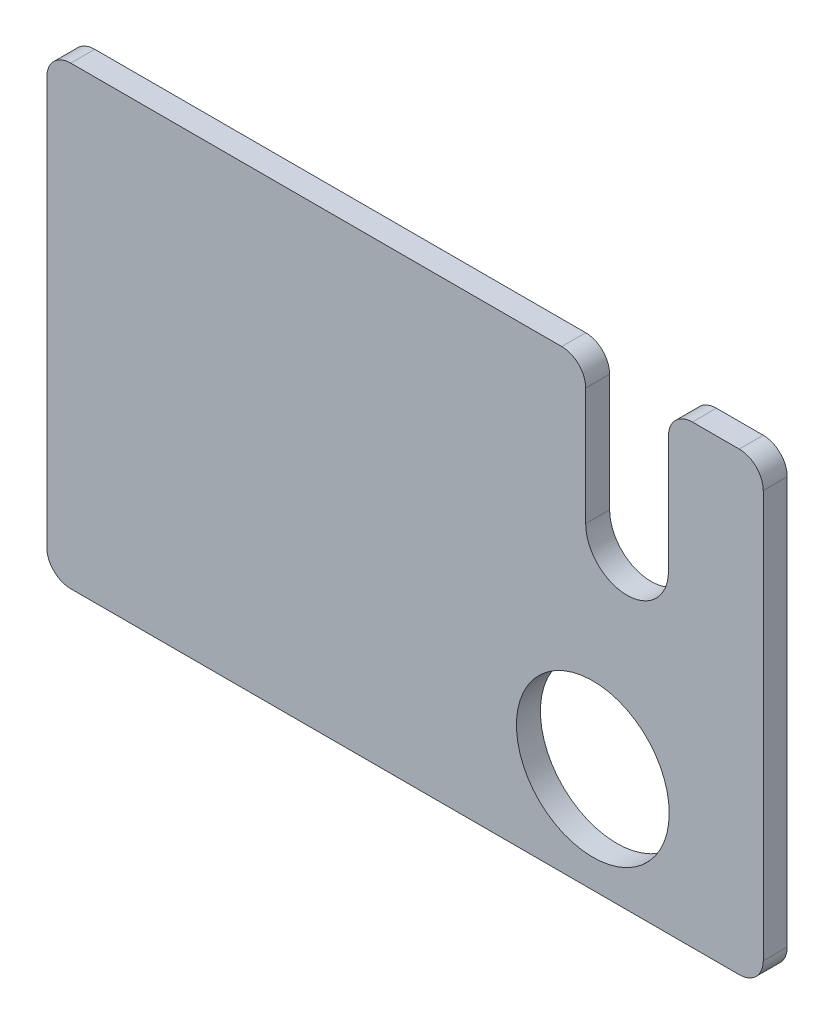
from build123d import *

# Parameters (mm, degrees)
SKETCH1_R           = 20.2311
BOSS_EXTRUDE1_DEPTH = 6.35
FILLET1_R           = 6.35


with BuildPart() as part:
    # Sketch1 → Boss-Extrude1 (new body)
    with BuildSketch(Plane.XY):
        with BuildLine():
            Line((-114.3, 72.540551407), (28.4099, 72.540551407))
            Line((28.4099, 72.540551407), (28.4099, 35.1155))
            ThreePointArc((28.4099, 35.1155), (39.37, 24.1554), (50.3301, 35.1155))
            Line((50.3301, 35.1155), (50.3301, 72.540551407))
            Line((50.3301, 72.540551407), (75.438, 72.540551407))
            Line((75.438, 72.540551407), (75.438, -48.0139375))
            Line((75.438, -48.0139375), (-114.3, -48.0139375))
            Line((-114.3, -48.0139375), (-114.3, 72.540551407))
        make_face()
        with Locations((30.30466222, -20.2311)):
            Circle(SKETCH1_R, mode=Mode.SUBTRACT)
    extrude(amount=BOSS_EXTRUDE1_DEPTH)

    # Fillet1
    fillet1_edges = [part.edges().sort_by_distance(p)[0] for p in [
        (-114.3, -48.0139375, 3.175),
        (-114.3, 72.540551407, 3.175),
        (75.438, -48.0139375, 3.175),
        (28.4099, 72.540551407, 3.175),
        (50.3301, 72.540551407, 3.175),
        (75.438, 72.540551407, 3.175),
    ]]
    fillet(fillet1_edges, radius=FILLET1_R)


solid = part.part
